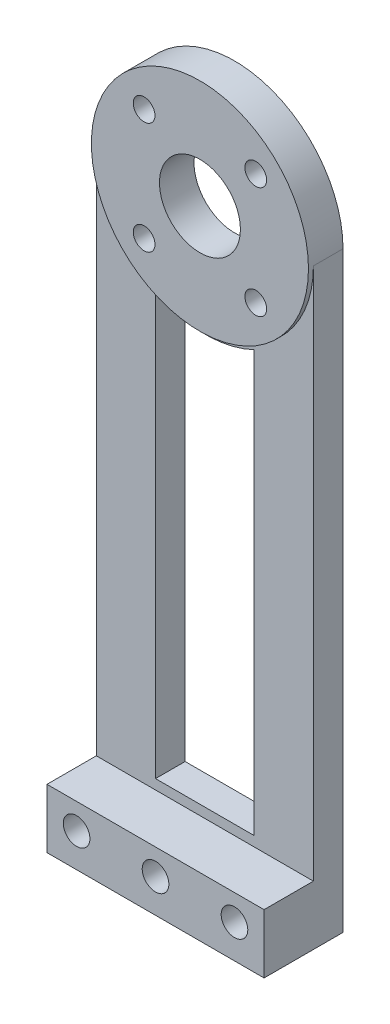
from build123d import *
from build123d.topology import SkipClean

# Parameters (mm, degrees)
BOSS_EXTRUDE1_DEPTH           = 3
BOSS_EXTRUDE2_START           = -0.5
SKETCH1_3_R                   = 11
BOSS_EXTRUDE2_DEPTH           = 0.5
SKETCH2_R                     = 4.1
SKETCH2_R_2                   = 1.1
CUT_EXTRUDE1_DEPTH            = 3.5
SKETCH2_3_R                   = 2
CUT_EXTRUDE2_DEPTH            = 0.5
CIRPATTERN2_COUNT             = 4
SKETCH1_6_W                   = 11
SKETCH1_6_H                   = 6
BOSS_EXTRUDE3_DEPTH           = 5
SKETCH4_R                     = 1.35
CUT_EXTRUDE4_DEPTH            = 8
LPATTERN2_COUNT               = 2
LPATTERN2_PITCH               = 8
LPATTERN2_COL_COUNT           = 2
LPATTERN2_COL_PITCH           = 8
BODY_MOVE_COPY1_START         = -3
BODY_MOVE_COPY1_OUTLINE_R     = 2
BODY_MOVE_COPY1_OUTLINE_R_2   = 4.1
BODY_MOVE_COPY1_DEPTH         = 3
BODY_MOVE_COPY1_START_2       = 3
BODY_MOVE_COPY1_2_OUTLINE_W   = 22
BODY_MOVE_COPY1_2_OUTLINE_H   = 6
BODY_MOVE_COPY1_2_OUTLINE_R   = 1.35
BODY_MOVE_COPY1_2_DEPTH       = 2
BODY_MOVE_COPY1_START_3       = -2.5
BODY_MOVE_COPY1_3_OUTLINE_R   = 2
BODY_MOVE_COPY1_3_OUTLINE_R_2 = 1.1
BODY_MOVE_COPY1_3_DEPTH       = 2
BODY_MOVE_COPY1_START_4       = 0.5
BODY_MOVE_COPY1_4_OUTLINE_R   = 1.1
BODY_MOVE_COPY1_4_OUTLINE_R_2 = 4.1
BODY_MOVE_COPY1_4_DEPTH       = 2.5
BODY_MOVE_COPY1_5_DEPTH       = 0.5
BODY_MOVE_COPY1_START_5       = -5
BODY_MOVE_COPY1_6_OUTLINE_W   = 22
BODY_MOVE_COPY1_6_OUTLINE_H   = 6
BODY_MOVE_COPY1_6_OUTLINE_R   = 1.35
BODY_MOVE_COPY1_6_DEPTH       = 2


# Read off the part's stored shape, not the designer's step: Body-Move/Copy1
with BuildPart() as part:
    # Sketch1 → Boss-Extrude1 (new body)
    with BuildSketch(Plane.XY):
        with BuildLine():
            Line((-11, 30), (-11, -30))
            Line((-11, -30), (11, -30))
            Line((11, -30), (11, 30))
            ThreePointArc((11, 30), (0, 41), (-11, 30))
        make_face()
        with BuildLine():
            Line((5, -23), (-5, -23))
            Line((-5, -23), (-5, 19.643842411))
            ThreePointArc((-5, 19.643842411), (0, 18.5), (5, 19.643842411))
            Line((5, 19.643842411), (5, -23))
        make_face(mode=Mode.SUBTRACT)
    extrude(amount=BOSS_EXTRUDE1_DEPTH)

    # Sketch1<3> → Boss-Extrude2 (add)
    with BuildSketch(Plane.XY.offset(BOSS_EXTRUDE2_START)):
        with Locations((0, 30)):
            Circle(SKETCH1_3_R)
    extrude(amount=BOSS_EXTRUDE2_DEPTH)

    # Sketch2 → Cut-Extrude1 (cut)
    with BuildSketch(Plane.XY.offset(3)):
        with Locations((0, 30)):
            Circle(SKETCH2_R)
        with Locations((5.656854249, 35.656854249)):
            Circle(SKETCH2_R_2)
    cut_extrude1 = extrude(amount=-CUT_EXTRUDE1_DEPTH, mode=Mode.SUBTRACT)

    # Sketch2<3> → Cut-Extrude2 (cut)
    with BuildSketch(Plane.XY.offset(3)):
        with Locations((5.656854249, 35.656854249)):
            Circle(SKETCH2_3_R)
    cut_extrude2 = extrude(amount=-CUT_EXTRUDE2_DEPTH, mode=Mode.SUBTRACT)

    # CirPattern2: Cut-Extrude1, Cut-Extrude2 ×4 about axis
    cirpattern2_axis = Axis((0, 30, 0), (0, 0, 1))
    add([cut_extrude1.rotate(cirpattern2_axis, i * 360 / CIRPATTERN2_COUNT) for i in range(1, CIRPATTERN2_COUNT)], mode=Mode.SUBTRACT)
    add([cut_extrude2.rotate(cirpattern2_axis, i * 360 / CIRPATTERN2_COUNT) for i in range(1, CIRPATTERN2_COUNT)], mode=Mode.SUBTRACT)

    # Sketch1<6> → Boss-Extrude3 (add)
    with BuildSketch(Plane.XY):
        with Locations((-5.5, -27)):
            Rectangle(SKETCH1_6_W, SKETCH1_6_H)
        with Locations((5.5, -27)):
            Rectangle(SKETCH1_6_W, SKETCH1_6_H)
    extrude(amount=-BOSS_EXTRUDE3_DEPTH)

    # Sketch4 → Cut-Extrude4 (cut)
    with BuildSketch(Plane.XY.offset(3)):
        with Locations((0, -26.6)):
            Circle(SKETCH4_R)
    cut_extrude4 = extrude(amount=-CUT_EXTRUDE4_DEPTH, mode=Mode.SUBTRACT)

    # LPattern2: Cut-Extrude4 ×2
    with Locations(*[(i * LPATTERN2_PITCH, 0, 0) for i in range(1, LPATTERN2_COUNT)]):
        add(cut_extrude4, mode=Mode.SUBTRACT)

    # LPattern2 col: Cut-Extrude4 ×2
    with Locations(*[(-i * LPATTERN2_COL_PITCH, 0, 0) for i in range(1, LPATTERN2_COL_COUNT)]):
        add(cut_extrude4, mode=Mode.SUBTRACT)

    # Body-Move/Copy1 outline → Body-Move/Copy1 (add)
    with BuildSketch(Plane.XY.offset(BODY_MOVE_COPY1_START)):
        with BuildLine():
            Line((-11, -24), (11, -24))
            Line((11, -24), (11, 30))
            ThreePointArc((11, 30), (0, 41), (-11, 30))
            Line((-11, 30), (-11, -24))
        make_face()
        with BuildLine():
            Line((5, 19.643842411), (5, -23))
            Line((5, -23), (-5, -23))
            Line((-5, -23), (-5, 19.643842411))
            ThreePointArc((-5, 19.643842411), (0, 18.5), (5, 19.643842411))
        make_face(mode=Mode.SUBTRACT)
        with Locations((5.656854249, 35.656854249)):
            Circle(BODY_MOVE_COPY1_OUTLINE_R, mode=Mode.SUBTRACT)
        with Locations((-5.656854249, 24.343145751)):
            Circle(BODY_MOVE_COPY1_OUTLINE_R, mode=Mode.SUBTRACT)
        with Locations((-5.656854249, 35.656854249)):
            Circle(BODY_MOVE_COPY1_OUTLINE_R, mode=Mode.SUBTRACT)
        with Locations((0, 30)):
            Circle(BODY_MOVE_COPY1_OUTLINE_R_2, mode=Mode.SUBTRACT)
        with Locations((5.656854249, 24.343145751)):
            Circle(BODY_MOVE_COPY1_OUTLINE_R, mode=Mode.SUBTRACT)
    extrude(amount=BODY_MOVE_COPY1_DEPTH)

    # Body-Move_Copy1 2 outline → Body-Move_Copy1 2 (add)
    with BuildSketch(Plane.XY.offset(BODY_MOVE_COPY1_START_2)):
        with Locations((0, -27)):
            Rectangle(BODY_MOVE_COPY1_2_OUTLINE_W, BODY_MOVE_COPY1_2_OUTLINE_H)
        with Locations((-8, -26.6)):
            Circle(BODY_MOVE_COPY1_2_OUTLINE_R, mode=Mode.SUBTRACT)
        with Locations((0, -26.6)):
            Circle(BODY_MOVE_COPY1_2_OUTLINE_R, mode=Mode.SUBTRACT)
        with Locations((8, -26.6)):
            Circle(BODY_MOVE_COPY1_2_OUTLINE_R, mode=Mode.SUBTRACT)
    extrude(amount=BODY_MOVE_COPY1_2_DEPTH)

    # Body-Move_Copy1 3 outline → Body-Move_Copy1 3 (add)
    # profile 1 of 4: a face of its own
    with BuildSketch(Plane.XY.offset(BODY_MOVE_COPY1_START_3)):
        with Locations((5.656854249, 35.656854249)):
            Circle(BODY_MOVE_COPY1_3_OUTLINE_R)
        with Locations((5.656854249, 35.656854249)):
            Circle(BODY_MOVE_COPY1_3_OUTLINE_R_2, mode=Mode.SUBTRACT)
    # profile 2 of 4: a face of its own
    with BuildSketch(Plane.XY.offset(BODY_MOVE_COPY1_START_3)):
        with Locations((5.656854249, 24.343145751)):
            Circle(BODY_MOVE_COPY1_3_OUTLINE_R)
        with Locations((5.656854249, 24.343145751)):
            Circle(BODY_MOVE_COPY1_3_OUTLINE_R_2, mode=Mode.SUBTRACT)
    # profile 3 of 4: a face of its own
    with BuildSketch(Plane.XY.offset(BODY_MOVE_COPY1_START_3)):
        with Locations((-5.656854249, 35.656854249)):
            Circle(BODY_MOVE_COPY1_3_OUTLINE_R)
        with Locations((-5.656854249, 35.656854249)):
            Circle(BODY_MOVE_COPY1_3_OUTLINE_R_2, mode=Mode.SUBTRACT)
    # profile 4 of 4: a face of its own
    with BuildSketch(Plane.XY.offset(BODY_MOVE_COPY1_START_3)):
        with Locations((-5.656854249, 24.343145751)):
            Circle(BODY_MOVE_COPY1_3_OUTLINE_R)
        with Locations((-5.656854249, 24.343145751)):
            Circle(BODY_MOVE_COPY1_3_OUTLINE_R_2, mode=Mode.SUBTRACT)
    extrude(amount=BODY_MOVE_COPY1_3_DEPTH)

    # Body-Move_Copy1 4 outline → Body-Move_Copy1 4 (cut)
    with BuildSketch(Plane.XY.offset(BODY_MOVE_COPY1_START_4)):
        with BuildLine():
            ThreePointArc((11, 30), (0, 41), (-11, 30))
            Line((-11, 30), (-11, -24))
            Line((-11, -24), (11, -24))
            Line((11, -24), (11, 30))
        make_face()
        with Locations((5.656854249, 35.656854249)):
            Circle(BODY_MOVE_COPY1_4_OUTLINE_R, mode=Mode.SUBTRACT)
        with Locations((0, 30)):
            Circle(BODY_MOVE_COPY1_4_OUTLINE_R_2, mode=Mode.SUBTRACT)
        with BuildLine():
            Line((5, -23), (-5, -23))
            Line((-5, -23), (-5, 19.643842411))
            ThreePointArc((-5, 19.643842411), (0, 18.5), (5, 19.643842411))
            Line((5, 19.643842411), (5, -23))
        make_face(mode=Mode.SUBTRACT)
        with Locations((-5.656854249, 24.343145751)):
            Circle(BODY_MOVE_COPY1_4_OUTLINE_R, mode=Mode.SUBTRACT)
        with Locations((-5.656854249, 35.656854249)):
            Circle(BODY_MOVE_COPY1_4_OUTLINE_R, mode=Mode.SUBTRACT)
        with Locations((5.656854249, 24.343145751)):
            Circle(BODY_MOVE_COPY1_4_OUTLINE_R, mode=Mode.SUBTRACT)
    extrude(amount=BODY_MOVE_COPY1_4_DEPTH, mode=Mode.SUBTRACT)

    # Body-Move_Copy1 5 outline → Body-Move_Copy1 5 (cut)
    with SkipClean():  # the faces are left unmerged after this step: merging them gives an invalid solid
        with BuildSketch(Plane.XY):
            with BuildLine():
                Line((-11, -24), (11, -24))
                Line((11, -24), (11, 30))
                ThreePointArc((11, 30), (0, 19), (-11, 30))
                Line((-11, 30), (-11, -24))
            make_face()
            with BuildLine():
                Line((5, 19.643842411), (5, -23))
                Line((5, -23), (-5, -23))
                Line((-5, -23), (-5, 19.643842411))
                ThreePointArc((-5, 19.643842411), (0, 18.5), (5, 19.643842411))
            make_face(mode=Mode.SUBTRACT)
        extrude(amount=BODY_MOVE_COPY1_5_DEPTH, mode=Mode.SUBTRACT)
    add(part.part.scale(1), mode=Mode.REPLACE)  # the faces are merged on a copy

    # Body-Move_Copy1 6 outline → Body-Move_Copy1 6 (cut)
    with BuildSketch(Plane.XY.offset(BODY_MOVE_COPY1_START_5)):
        with Locations((0, -27)):
            Rectangle(BODY_MOVE_COPY1_6_OUTLINE_W, BODY_MOVE_COPY1_6_OUTLINE_H)
        with Locations((-8, -26.6)):
            Circle(BODY_MOVE_COPY1_6_OUTLINE_R, mode=Mode.SUBTRACT)
        with Locations((0, -26.6)):
            Circle(BODY_MOVE_COPY1_6_OUTLINE_R, mode=Mode.SUBTRACT)
        with Locations((8, -26.6)):
            Circle(BODY_MOVE_COPY1_6_OUTLINE_R, mode=Mode.SUBTRACT)
    extrude(amount=BODY_MOVE_COPY1_6_DEPTH, mode=Mode.SUBTRACT)


solid = part.part
